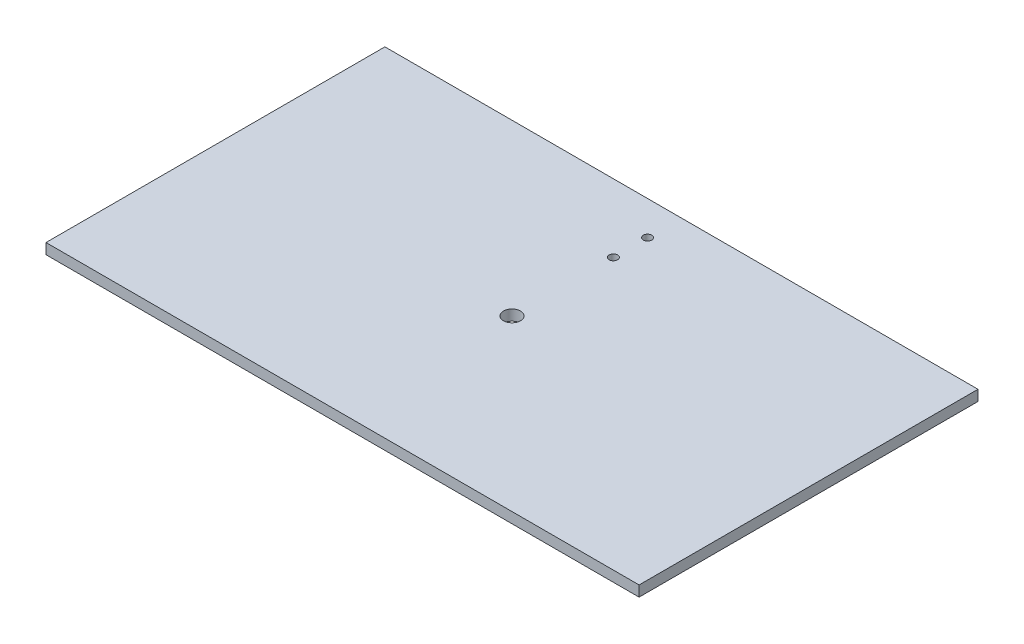
from build123d import *

# Parameters (mm, degrees)
SKETCH2_W                         = 355.6
SKETCH2_H                         = 203.2
BOSS_EXTRUDE1_DEPTH               = 6.35
SKETCH3_R                         = 2.54
CUT_EXTRUDE1_DEPTH                = 205.879775722
TAP_DRILL_FOR_M12X1_75_TAP1_D     = 10.2
TAP_DRILL_FOR_M12X1_75_TAP1_DEPTH = 19.05
TAP_DRILL_FOR_M12X1_75_TAP1_TIP   = 3.064389157


with BuildPart() as part:
    # Sketch2 → Boss-Extrude1 (new body)
    with BuildSketch(Plane(origin=(0, 0, 0), x_dir=(1, 0, 0), z_dir=(0, 1, 0))):
        Rectangle(SKETCH2_W, SKETCH2_H)
    extrude(amount=BOSS_EXTRUDE1_DEPTH)

    # Sketch3 → Cut-Extrude1 (cut, through all)
    with BuildSketch(Plane(origin=(0, 6.35, 0), x_dir=(1, 0, 0), z_dir=(0, 1, 0))):
        with Locations((0, 81.28)):
            Circle(SKETCH3_R)
        with Locations((0, 60.779914)):
            Circle(SKETCH3_R)
    extrude(amount=-CUT_EXTRUDE1_DEPTH, mode=Mode.SUBTRACT)

    # Tap Drill for M12x1.75 Tap1
    with Locations(Plane(origin=(0, 6.35, 0), x_dir=(1, 0, 0), z_dir=(0, 1, 0))):
        with Locations((0, 0)):
            Hole(TAP_DRILL_FOR_M12X1_75_TAP1_D / 2, depth=TAP_DRILL_FOR_M12X1_75_TAP1_DEPTH)
            with Locations((0, 0, -(TAP_DRILL_FOR_M12X1_75_TAP1_DEPTH + TAP_DRILL_FOR_M12X1_75_TAP1_TIP / 2))):  # 118° drill point
                Cone(0, TAP_DRILL_FOR_M12X1_75_TAP1_D / 2, TAP_DRILL_FOR_M12X1_75_TAP1_TIP, mode=Mode.SUBTRACT)


solid = part.part
